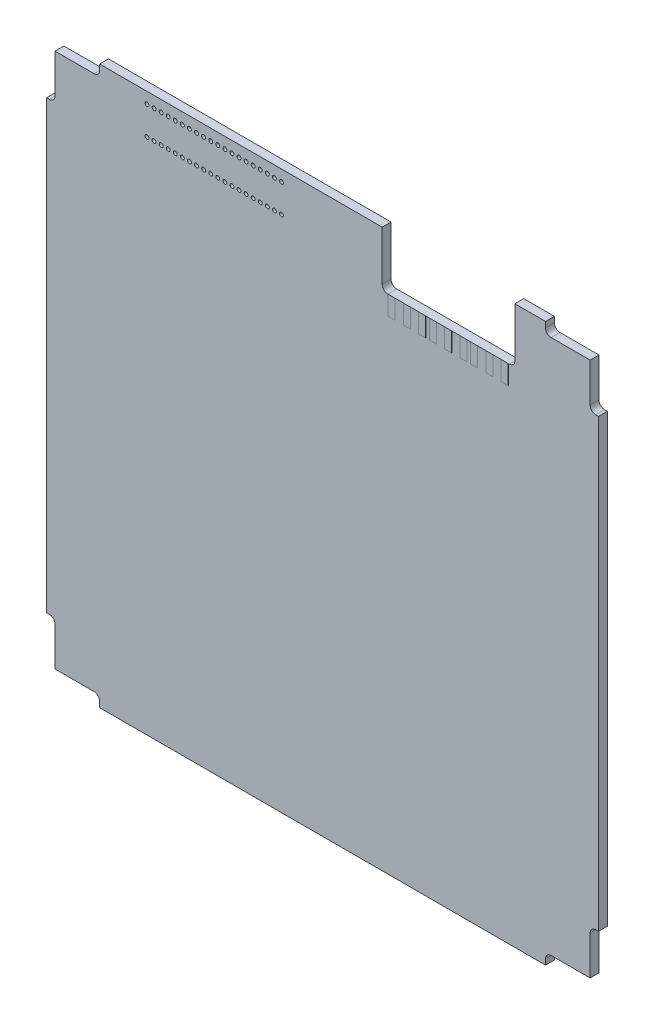
from build123d import *

# Parameters (mm, degrees)
BOSS_EXTRUDE1_DEPTH = 1.5875
FILLET1_R           = 1
SKETCH2_R           = 0.35
CUT_EXTRUDE1_DEPTH  = 71.728496069
CUT_EXTRUDE2_DEPTH  = 9.8806
FILLET2_R           = 1
SKETCH5_OUTSIDE_W   = 130.286
SKETCH5_OUTSIDE_H   = 130.286
SKETCH5_OUTSIDE_W_2 = 99
SKETCH5_OUTSIDE_H_2 = 100
CUT_EXTRUDE3_DEPTH  = 71.728496069
SKETCH6_W           = 1.27
SKETCH6_H           = 3.43
BOSS_EXTRUDE2_DEPTH = 0.01


with BuildPart() as part:
    # Sketch1 → Boss-Extrude1 (new body)
    with BuildSketch(Plane.XY):
        Polygon((40, 50), (-40, 50), (-40, 48), (-48, 48), (-48, 40), (-50, 40), (-50, -37.864895224), (-50, -40), (-48, -40), (-48, -48), (-40, -48), (-40, -50), (-37.864895224, -50), (40, -50), (40, -48), (48, -48), (48, -40), (50, -40), (50, 40), (48, 40), (48, 48), (40, 48), align=None)
    extrude(amount=BOSS_EXTRUDE1_DEPTH)

    # Fillet1
    fillet1_edges = [part.edges().sort_by_distance(p)[0] for p in [
        (-48, -40, 0.79375),
        (-40, -48, 0.79375),
        (40, -48, 0.79375),
        (48, -40, 0.79375),
        (48, 40, 0.79375),
        (40, 48, 0.79375),
        (-40, 48, 0.79375),
        (-48, 40, 0.79375),
    ]]
    fillet(fillet1_edges, radius=FILLET1_R)

    # Sketch2 → Cut-Extrude1 (cut, through all)
    with BuildSketch(Plane.XY.offset(1.5875)):
        with Locations((-31.5, 48)):
            Circle(SKETCH2_R)
        with Locations((-30.23, 48)):
            Circle(SKETCH2_R)
        with Locations((-28.96, 48)):
            Circle(SKETCH2_R)
        with Locations((-27.69, 48)):
            Circle(SKETCH2_R)
        with Locations((-26.42, 48)):
            Circle(SKETCH2_R)
        with Locations((-25.15, 48)):
            Circle(SKETCH2_R)
        with Locations((-23.88, 48)):
            Circle(SKETCH2_R)
        with Locations((-22.61, 48)):
            Circle(SKETCH2_R)
        with Locations((-21.34, 48)):
            Circle(SKETCH2_R)
        with Locations((-20.07, 48)):
            Circle(SKETCH2_R)
        with Locations((-18.8, 48)):
            Circle(SKETCH2_R)
        with Locations((-17.53, 48)):
            Circle(SKETCH2_R)
        with Locations((-16.26, 48)):
            Circle(SKETCH2_R)
        with Locations((-14.99, 48)):
            Circle(SKETCH2_R)
        with Locations((-13.72, 48)):
            Circle(SKETCH2_R)
        with Locations((-12.45, 48)):
            Circle(SKETCH2_R)
        with Locations((-11.18, 48)):
            Circle(SKETCH2_R)
        with Locations((-9.91, 48)):
            Circle(SKETCH2_R)
        with Locations((-8.64, 48)):
            Circle(SKETCH2_R)
        with Locations((-7.37, 48)):
            Circle(SKETCH2_R)
        with Locations((-30.23, 42.92)):
            Circle(SKETCH2_R)
        with Locations((-28.96, 42.92)):
            Circle(SKETCH2_R)
        with Locations((-27.69, 42.92)):
            Circle(SKETCH2_R)
        with Locations((-26.42, 42.92)):
            Circle(SKETCH2_R)
        with Locations((-25.15, 42.92)):
            Circle(SKETCH2_R)
        with Locations((-23.88, 42.92)):
            Circle(SKETCH2_R)
        with Locations((-22.61, 42.92)):
            Circle(SKETCH2_R)
        with Locations((-21.34, 42.92)):
            Circle(SKETCH2_R)
        with Locations((-20.07, 42.92)):
            Circle(SKETCH2_R)
        with Locations((-18.8, 42.92)):
            Circle(SKETCH2_R)
        with Locations((-17.53, 42.92)):
            Circle(SKETCH2_R)
        with Locations((-16.26, 42.92)):
            Circle(SKETCH2_R)
        with Locations((-14.99, 42.92)):
            Circle(SKETCH2_R)
        with Locations((-13.72, 42.92)):
            Circle(SKETCH2_R)
        with Locations((-12.45, 42.92)):
            Circle(SKETCH2_R)
        with Locations((-11.18, 42.92)):
            Circle(SKETCH2_R)
        with Locations((-9.91, 42.92)):
            Circle(SKETCH2_R)
        with Locations((-8.64, 42.92)):
            Circle(SKETCH2_R)
        with Locations((-7.37, 42.92)):
            Circle(SKETCH2_R)
        with Locations((-31.5, 42.92)):
            Circle(SKETCH2_R)
    extrude(amount=-CUT_EXTRUDE1_DEPTH, mode=Mode.SUBTRACT)

    # Sketch3 → Cut-Extrude2 (cut)
    with BuildSketch(Plane(origin=(0, 50, 0), x_dir=(1, 0, 0), z_dir=(0, 1, 0))):
        Polygon((10.7, 0), (19.7, 0), (34.5, 0), (34.5, -1.5875), (19.7, -1.5875), (10.7, -1.5875), align=None)
    extrude(amount=-CUT_EXTRUDE2_DEPTH, mode=Mode.SUBTRACT)

    # Fillet2
    fillet2_edges = [part.edges().sort_by_distance(p)[0] for p in [
        (10.7, 40.1194, 0.79375),
        (34.5, 40.1194, 0.79375),
    ]]
    fillet(fillet2_edges, radius=FILLET2_R)

    # Sketch5 outside → Cut-Extrude3 (cut, through all)
    with BuildSketch(Plane(origin=(0, 0, 0), x_dir=(-1, 0, 0), z_dir=(0, 0, -1))):
        Rectangle(SKETCH5_OUTSIDE_W, SKETCH5_OUTSIDE_H)
        Rectangle(SKETCH5_OUTSIDE_W_2, SKETCH5_OUTSIDE_H_2, mode=Mode.SUBTRACT)
    extrude(amount=-CUT_EXTRUDE3_DEPTH, mode=Mode.SUBTRACT)

    # Sketch6 → Boss-Extrude2 (add)
    with BuildSketch(Plane.XY.offset(1.5875)):
        with Locations((12.4, 38.4044)):
            Rectangle(SKETCH6_W, SKETCH6_H)
        with Locations((15.14, 38.4044)):
            Rectangle(SKETCH6_W, SKETCH6_H)
        with Locations((17.88, 38.4044)):
            Rectangle(SKETCH6_W, SKETCH6_H)
        with Locations((19.8, 38.4044)):
            Rectangle(SKETCH6_W, SKETCH6_H)
        with Locations((22.54, 38.4044)):
            Rectangle(SKETCH6_W, SKETCH6_H)
        with Locations((25.28, 38.4044)):
            Rectangle(SKETCH6_W, SKETCH6_H)
        with Locations((27.2, 38.4044)):
            Rectangle(SKETCH6_W, SKETCH6_H)
        with Locations((29.94, 38.4044)):
            Rectangle(SKETCH6_W, SKETCH6_H)
        with Locations((32.68, 38.4044)):
            Rectangle(SKETCH6_W, SKETCH6_H)
    extrude(amount=BOSS_EXTRUDE2_DEPTH)


solid = part.part
